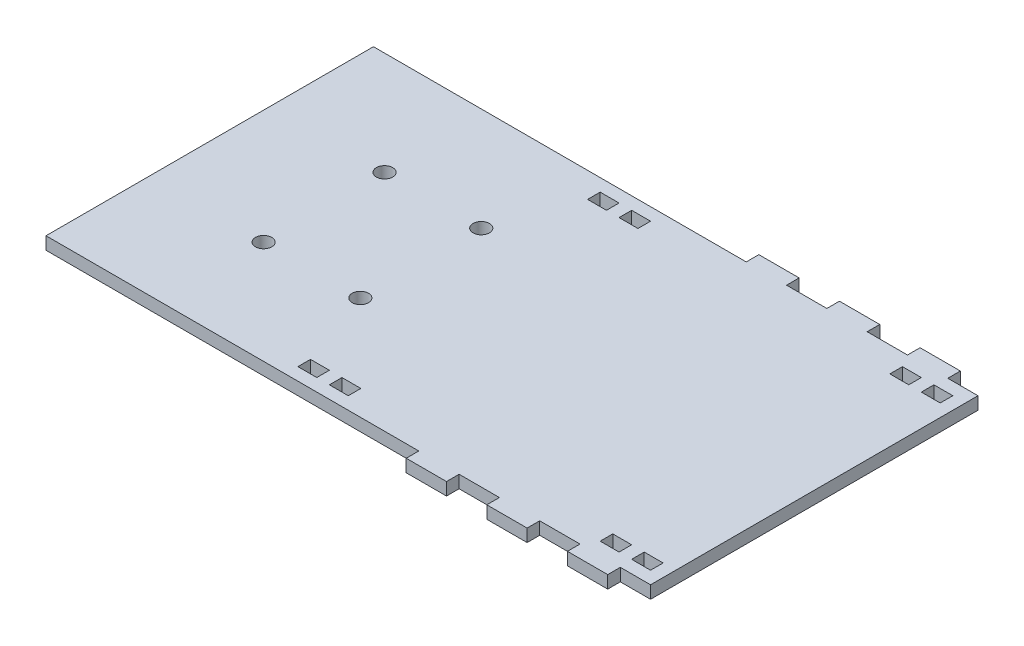
from build123d import *

# Parameters (mm, degrees)
BOSS_EXTRUDE1_DEPTH         = 3.175
SKETCH2_R                   = 2.06375
CASTER_MOUNTING_HOLES_DEPTH = 89.274136218
SKETCH3_W                   = 4.7625
SKETCH3_H                   = 3.175
CUT_EXTRUDE1_DEPTH          = 89.274136218
LPATTERN1_COUNT             = 2
LPATTERN1_PITCH             = 76.2
LPATTERN1_COUNT_DIR2        = 2
LPATTERN1_PITCH_DIR2        = 73.025


with BuildPart() as part:
    # Sketch1 → Boss-Extrude1 (new body)
    with BuildSketch(Plane(origin=(0, 0, 0), x_dir=(1, 0, 0), z_dir=(0, 1, 0))):
        Polygon((27.94, -41.275), (38.1, -41.275), (38.1, -44.45), (48.26, -44.45), (48.26, -41.275), (58.42, -41.275), (58.42, -44.45), (68.58, -44.45), (68.58, -41.275), (76.2, -41.275), (76.2, 41.275), (68.58, 41.275), (68.58, 44.45), (58.42, 44.45), (58.42, 41.275), (48.26, 41.275), (48.26, 44.45), (38.1, 44.45), (38.1, 41.275), (27.94, 41.275), (27.94, 44.45), (17.78, 44.45), (17.78, 41.275), (-76.2, 41.275), (-76.2, -41.275), (17.78, -41.275), (17.78, -44.45), (27.94, -44.45), align=None)
    extrude(amount=BOSS_EXTRUDE1_DEPTH)

    # Sketch2 → Caster Mounting Holes (cut, through all)
    with BuildSketch(Plane(origin=(0, 3.175, 0), x_dir=(1, 0, 0), z_dir=(0, 1, 0))):
        with Locations((-47.3754273, 15.24)):
            Circle(SKETCH2_R)
        with Locations((-22.9914273, 15.24)):
            Circle(SKETCH2_R)
        with Locations((-22.9914273, -15.24)):
            Circle(SKETCH2_R)
        with Locations((-47.3754273, -15.24)):
            Circle(SKETCH2_R)
    extrude(amount=-CASTER_MOUNTING_HOLES_DEPTH, mode=Mode.SUBTRACT)

    # Sketch3 → Cut-Extrude1 (cut, through all)
    with BuildSketch(Plane(origin=(0, 3.175, 0), x_dir=(1, 0, 0), z_dir=(0, 1, 0))):
        with Locations((62.70625, 36.5125)):
            Rectangle(SKETCH3_W, SKETCH3_H)
        with Locations((70.64375, 36.5125)):
            Rectangle(SKETCH3_W, SKETCH3_H)
    cut_extrude1 = extrude(amount=-CUT_EXTRUDE1_DEPTH, mode=Mode.SUBTRACT)

    # LPattern1: Cut-Extrude1 2 × 2
    with Locations(*[(-i * LPATTERN1_PITCH, 0, j * LPATTERN1_PITCH_DIR2) for i in range(LPATTERN1_COUNT) for j in range(LPATTERN1_COUNT_DIR2) if (i, j) != (0, 0)]):
        add(cut_extrude1, mode=Mode.SUBTRACT)


solid = part.part
